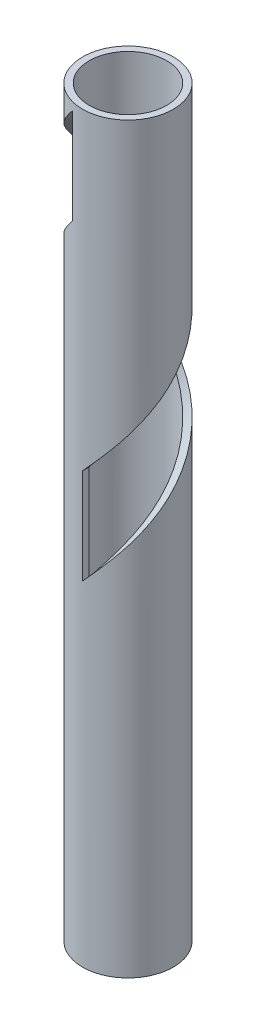
from build123d import *

# Parameters (mm, degrees)
SKETCH1_R           = 21.717
SKETCH1_R_2         = 18.542
BOSS_EXTRUDE1_DEPTH = 355.6
CUT_SWEEP1_PITCH    = 152.4


with BuildPart() as part:
    # Sketch1 → Boss-Extrude1 (new body)
    with BuildSketch(Plane(origin=(0, 0, 0), x_dir=(1, 0, 0), z_dir=(0, 1, 0))):
        with Locations(Location((0, 0, 0), (0, 0, 270))):
            Circle(SKETCH1_R)
        with Locations(Location((0, 0, 0), (0, 0, 270))):
            Circle(SKETCH1_R_2, mode=Mode.SUBTRACT)
    extrude(amount=BOSS_EXTRUDE1_DEPTH)

    # Cut-Sweep1: the profile of Sketch6 profile screwed along a right-hand helix of 0.96 turns, 38 arcs to a turn; built about Z, then put on its axis
    cut_sweep1_z = Axis((0, 0, 0), (0, 0, 1))
    cut_sweep1_corners = [(18.542, 0, -22.86), (21.7173, 0, -22.86), (21.7173, 0, 22.86), (18.542, 0, 22.86)]
    with BuildLine(mode=Mode.PRIVATE) as cut_sweep1_profile:
        Line(cut_sweep1_corners[0], cut_sweep1_corners[1])
        Line(cut_sweep1_corners[1], cut_sweep1_corners[2])
        Line(cut_sweep1_corners[2], cut_sweep1_corners[3])
        Line(cut_sweep1_corners[3], cut_sweep1_corners[0])
    cut_sweep1_cap = Face(cut_sweep1_profile.wire())
    cut_sweep1_turn_angles = [0, 4.736842105, 9.473684211, 14.210526316, 18.947368421, 23.684210526, 28.421052632, 33.157894737, 37.894736842, 42.631578947, 47.368421053, 52.105263158, 56.842105263, 61.578947368, 66.315789474, 71.052631579, 75.789473684, 80.526315789, 85.263157895, 90, 94.736842105, 99.473684211, 104.210526316, 108.947368421, 113.684210526, 118.421052632, 123.157894737, 127.894736842, 132.631578947, 137.368421053, 142.105263158, 146.842105263, 151.578947368, 156.315789474, 161.052631579, 165.789473684, 170.526315789, 175.263157895, 180, 184.736842105, 189.473684211, 194.210526316, 198.947368421, 203.684210526, 208.421052632, 213.157894737, 217.894736842, 222.631578947, 227.368421053, 232.105263158, 236.842105263, 241.578947368, 246.315789474, 251.052631579, 255.789473684, 260.526315789, 265.263157895, 270, 274.736842105, 279.473684211, 284.210526316, 288.947368421, 293.684210526, 298.421052632, 303.157894737, 307.894736842, 312.631578947, 317.368421053, 322.105263158, 326.842105263, 331.578947368, 336.315789474, 341.052631579, 343.326315789, 345.6]
    cut_sweep1_turn_weights = [1, 0.9965844930066698, 1, 0.9965844930066698, 1, 0.9965844930066698, 1, 0.9965844930066698, 1, 0.9965844930066698, 1, 0.9965844930066698, 1, 0.9965844930066698, 1, 0.9965844930066698, 1, 0.9965844930066698, 1, 0.9965844930066698, 1, 0.9965844930066698, 1, 0.9965844930066698, 1, 0.9965844930066698, 1, 0.9965844930066698, 1, 0.9965844930066698, 1, 0.9965844930066698, 1, 0.9965844930066698, 1, 0.9965844930066698, 1, 0.9965844930066698, 1, 0.9965844930066698, 1, 0.9965844930066698, 1, 0.9965844930066698, 1, 0.9965844930066698, 1, 0.9965844930066698, 1, 0.9965844930066698, 1, 0.9965844930066698, 1, 0.9965844930066698, 1, 0.9965844930066698, 1, 0.9965844930066698, 1, 0.9965844930066698, 1, 0.9965844930066698, 1, 0.9965844930066698, 1, 0.9965844930066698, 1, 0.9965844930066698, 1, 0.9965844930066698, 1, 0.9965844930066698, 1, 0.9992127221406268, 1]
    cut_sweep1_turn_rails = [Edge.make_bspline([Vector(p[0], p[1], 0).rotate(cut_sweep1_z, cut_sweep1_turn_angles[k]) / cut_sweep1_turn_weights[k] + Vector(0, 0, p[2] + CUT_SWEEP1_PITCH * cut_sweep1_turn_angles[k] / 360) for k in range(75)], [0, 0, 0, 1, 1, 2, 2, 3, 3, 4, 4, 5, 5, 6, 6, 7, 7, 8, 8, 9, 9, 10, 10, 11, 11, 12, 12, 13, 13, 14, 14, 15, 15, 16, 16, 17, 17, 18, 18, 19, 19, 20, 20, 21, 21, 22, 22, 23, 23, 24, 24, 25, 25, 26, 26, 27, 27, 28, 28, 29, 29, 30, 30, 31, 31, 32, 32, 33, 33, 34, 34, 35, 35, 36, 36, 37, 37, 37], 2, cut_sweep1_turn_weights) for p in cut_sweep1_corners]
    cut_sweep1_turn_sides = [Face.make_surface_from_curves(cut_sweep1_turn_rails[p[0]], cut_sweep1_turn_rails[p[1]]) for p in [(0, 1), (1, 2), (2, 3), (3, 0)]]
    cut_sweep1 = Plane(origin=(0, 182.88, 0), x_dir=(0, 0, 1), z_dir=(0, 1, 0)) * Solid(Shell([*cut_sweep1_turn_sides, cut_sweep1_cap, cut_sweep1_cap.rotate(cut_sweep1_z, 345.6).moved(Location((0, 0, CUT_SWEEP1_PITCH * 345.6 / 360)))]))
    add(cut_sweep1, mode=Mode.SUBTRACT)


solid = part.part
